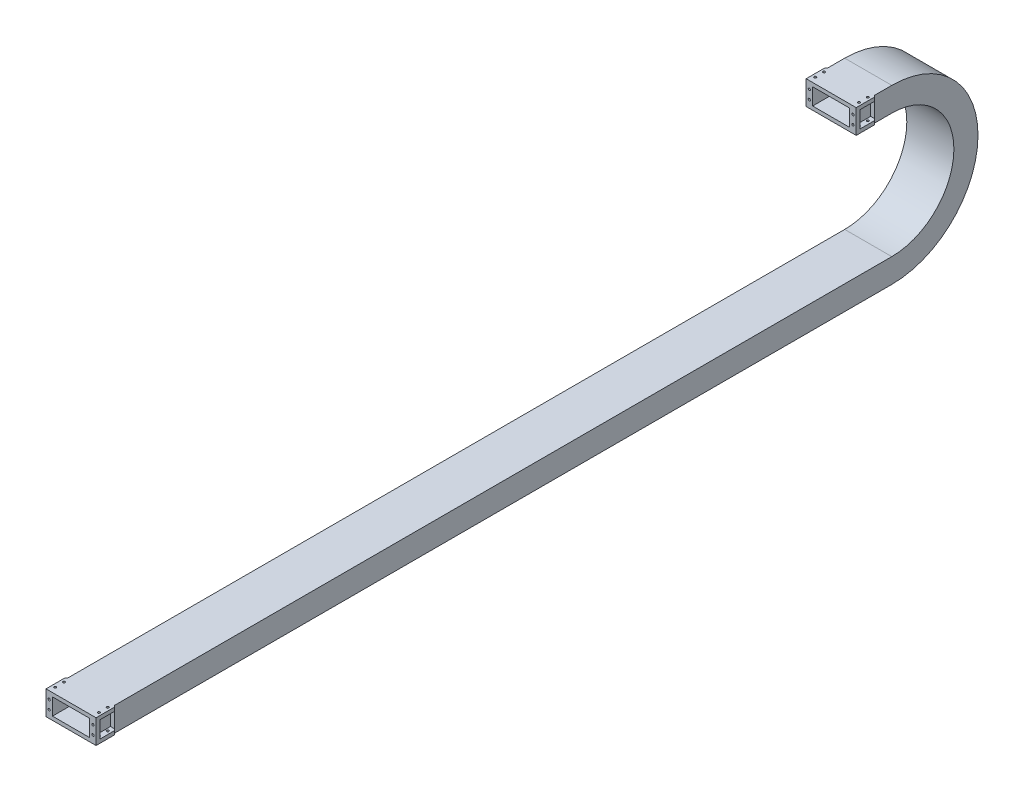
from build123d import *

# Parameters (mm, degrees)
SKETCH_1_W                = 127
SKETCH_1_H                = 65
SKETCH_1_W_2              = 100
SKETCH_1_H_2              = 45
SKETCH_5_W                = 50
SKETCH_5_H                = 65
EXTRUDE_1_DEPTH           = 4
SKETCH_6_W                = 50
SKETCH_6_H                = 65
EXTRUDE_2_DEPTH           = 4
CHAMFER_1_SIZE            = 4
SKETCH_9_W                = 44
SKETCH_9_H                = 45
CUT_EXTRUDE_1_DEPTH       = 15
SKETCH_10_W               = 44
SKETCH_10_H               = 45
CUT_EXTRUDE_2_DEPTH       = 15
HOLE_WIZARD_6_0_6_1_D     = 6
HOLE_WIZARD_6_0_6_2_D     = 6
HOLE_WIZARD_6_0_6_2_DEPTH = 65
HOLE_WIZARD_6_0_6_3_D     = 6
HOLE_WIZARD_6_0_6_3_DEPTH = 10
HOLE_WIZARD_6_0_6_4_D     = 6
HOLE_WIZARD_6_0_6_4_DEPTH = 10


with BuildPart() as part:
    # 掃出1: sweep along a path in 草圖2
    with BuildLine(Plane(origin=(0, 0, 0), x_dir=(0, 0, -1), z_dir=(1, 0, 0))) as sweep_1_path:
        Line((0, 0), (2150, 0))
        ThreePointArc((2150, 0), (2350, 200), (2150, 400))
        Line((2150, 400), (2050, 400))
    # 草圖1 → 掃出1 (sweep)
    with BuildSketch(Plane.XY):
        Rectangle(SKETCH_1_W, SKETCH_1_H)
        Rectangle(SKETCH_1_W_2, SKETCH_1_H_2, mode=Mode.SUBTRACT)
    sweep(path=sweep_1_path.line)

    # 草圖5 → 伸長1 (add)
    with BuildSketch(Plane(origin=(63.5, 0, 0), x_dir=(0, 0, -1), z_dir=(1, 0, 0))):
        with Locations((25, 0)):
            Rectangle(SKETCH_5_W, SKETCH_5_H)
        with Locations((2075, 400)):
            Rectangle(SKETCH_5_W, SKETCH_5_H)
    extrude(amount=EXTRUDE_1_DEPTH)

    # 草圖6 → 伸長2 (add)
    with BuildSketch(Plane.ZY.offset(63.5)):
        with Locations((-2075, 400)):
            Rectangle(SKETCH_6_W, SKETCH_6_H)
        with Locations((-25, 0)):
            Rectangle(SKETCH_6_W, SKETCH_6_H)
    extrude(amount=EXTRUDE_2_DEPTH)

    # 導角1
    chamfer_1_edges = [part.edges().sort_by_distance(p)[0] for p in [
        (63.5, 0, -50),
        (63.5, 400, -2100),
        (-63.5, 400, -2100),
        (-63.5, 0, -50),
    ]]
    chamfer(chamfer_1_edges, length=CHAMFER_1_SIZE - 0.0001)  # a hair under: the kernel refuses the full size

    # 草圖9 → 除料-伸長1 (cut)
    with BuildSketch(Plane(origin=(67.5, 0, 0), x_dir=(0, 0, -1), z_dir=(1, 0, 0))):
        with Locations((32, 0)):
            Rectangle(SKETCH_9_W, SKETCH_9_H)
        with Locations((2082, 400)):
            Rectangle(SKETCH_9_W, SKETCH_9_H)
    extrude(amount=-CUT_EXTRUDE_1_DEPTH, mode=Mode.SUBTRACT)

    # 草圖10 → 除料-伸長2 (cut)
    with BuildSketch(Plane.ZY.offset(67.5)):
        with Locations((-2082, 400)):
            Rectangle(SKETCH_10_W, SKETCH_10_H)
        with Locations((-32, 0)):
            Rectangle(SKETCH_10_W, SKETCH_10_H)
    extrude(amount=-CUT_EXTRUDE_2_DEPTH, mode=Mode.SUBTRACT)

    # Ø6.0 (6) 直徑孔1 (through all)
    with Locations(Plane(origin=(0, 32.5, 0), x_dir=(-1, 0, 0), z_dir=(0, 1, 0))):
        with Locations((59, -40), (59, -16), (-59, -16), (-59, -40)):
            Hole(HOLE_WIZARD_6_0_6_1_D / 2)

    # Ø6.0 (6) 直徑孔2
    with Locations(Plane(origin=(0, 432.5, 0), x_dir=(-1, 0, 0), z_dir=(0, 1, 0))):
        with Locations((59, -2090), (59, -2066), (-59, -2090), (-59, -2066)):
            Hole(HOLE_WIZARD_6_0_6_2_D / 2, depth=HOLE_WIZARD_6_0_6_2_DEPTH)

    # Ø6.0 (6) 直徑孔3
    with Locations(Plane.XY):
        with Locations((-59, 12), (-59, -12), (59, 12), (59, -12)):
            Hole(HOLE_WIZARD_6_0_6_3_D / 2, depth=HOLE_WIZARD_6_0_6_3_DEPTH)

    # Ø6.0 (6) 直徑孔4
    with Locations(Plane.XY.offset(-2050)):
        with Locations((-59, 412), (-59, 388), (59, 412), (59, 388)):
            Hole(HOLE_WIZARD_6_0_6_4_D / 2, depth=HOLE_WIZARD_6_0_6_4_DEPTH)


solid = part.part
